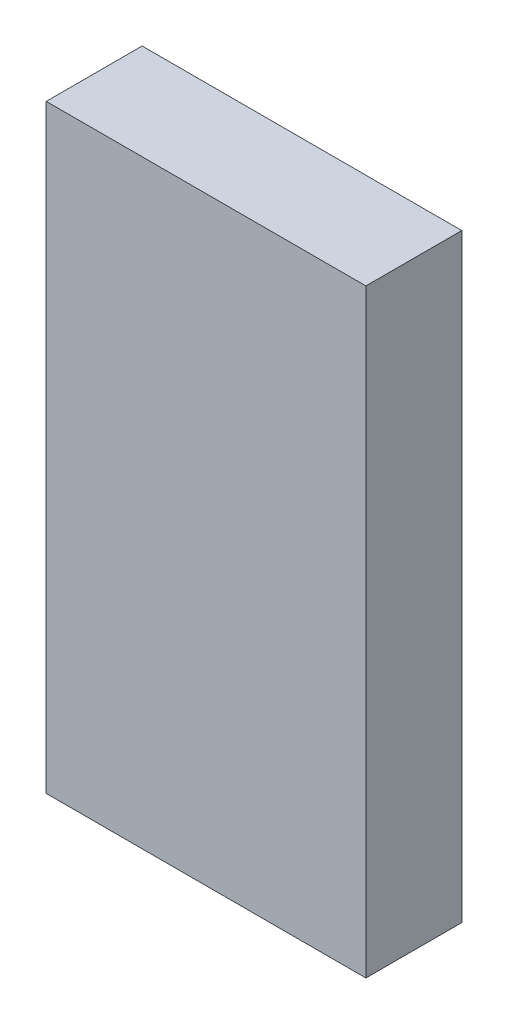
from build123d import *

# Parameters (mm, degrees)
SKETCH1_W           = 40
SKETCH1_H           = 12
BOSS_EXTRUDE1_DEPTH = 37.5


with BuildPart() as part:
    # Sketch1 → Boss-Extrude1 (new, symmetric)
    with BuildSketch(Plane(origin=(0, 0, 0), x_dir=(1, 0, 0), z_dir=(0, 1, 0))):
        Rectangle(SKETCH1_W, SKETCH1_H)
    extrude(amount=BOSS_EXTRUDE1_DEPTH, both=True)


solid = part.part
